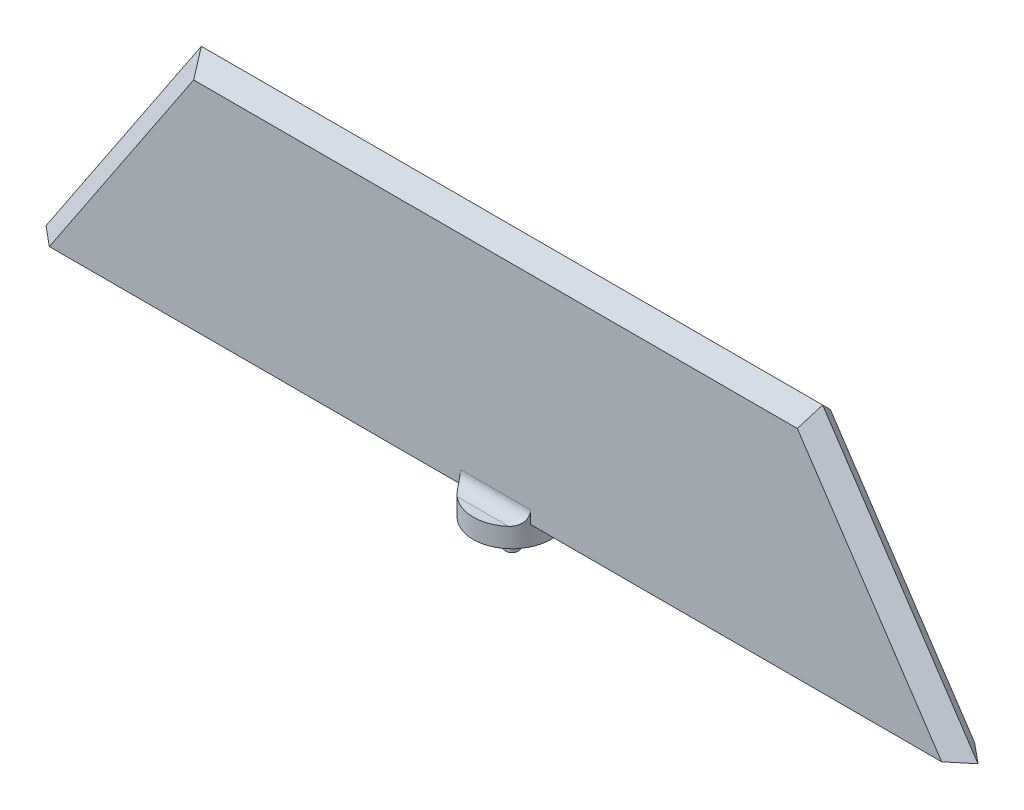
from build123d import *

# Parameters (mm, degrees)
SALIENTE_EXTRUIR1_DEPTH = 2.125
CROQUIS2_R              = 5
SALIENTE_EXTRUIR2_DEPTH = 2.5
REDONDEO1_R             = 1.625
SKETCH1_R               = 2.45
CUT_EXTRUDE1_DEPTH      = 3.1
CHAMFER1_SIZE           = 2.125
CROQUIS3_R              = 0.8
SALIENTE_EXTRUIR3_DEPTH = 6.5


# Some blends are built 0.0001 mm under size
with BuildPart() as part:
    # Croquis1 → Saliente-Extruir1 (new, symmetric)
    with BuildSketch(Plane.XY):
        Polygon((60, 0), (-60, 0), (-40, 30), (40, 30), align=None)
    extrude(amount=SALIENTE_EXTRUIR1_DEPTH, both=True)

    # Croquis2 → Saliente-Extruir2 (add)
    with BuildSketch(Plane.XZ):
        with Locations(Location((0, 0, 0), (0, 0, 25.150663413))):
            Circle(CROQUIS2_R)
    extrude(amount=SALIENTE_EXTRUIR2_DEPTH)

    # Redondeo1
    # the kernel refuses this fillet: 1.625 mm, written as the material it adds along each edge
    with BuildSketch(Plane(origin=(8.588466748, 0, -2.125), x_dir=(0, 1, 0), z_dir=(-1, 0, 0))) as redondeo1_piece_1_section:
        with BuildLine():
            CenterArc((REDONDEO1_R, REDONDEO1_R), REDONDEO1_R, 180, 90)
            Line((0, REDONDEO1_R), (0, 0))
            Line((0, 0), (REDONDEO1_R, 0))
        make_face()
    redondeo1_piece_1 = extrude(amount=17.176933495, mode=Mode.PRIVATE)
    redondeo1_piece_1 = redondeo1_piece_1 & Plane(origin=(0, 0.370660795, 0), x_dir=(0.9051933495081991, 0, 0.4250000000072087), z_dir=(0, 1, 0)) * Cylinder(5, 41, mode=Mode.PRIVATE)
    add(redondeo1_piece_1)
    with BuildSketch(Plane(origin=(8.588466748, 0, 2.125), x_dir=(0, 1, 0), z_dir=(-1, 0, 0))) as redondeo1_piece_2_section:
        with BuildLine():
            CenterArc((REDONDEO1_R, -REDONDEO1_R), REDONDEO1_R, 90, 90)
            Line((0, -REDONDEO1_R), (0, 0))
            Line((0, 0), (REDONDEO1_R, 0))
        make_face()
    redondeo1_piece_2 = extrude(amount=17.176933495, mode=Mode.PRIVATE)
    redondeo1_piece_2 = redondeo1_piece_2 & Plane(origin=(0, 0.370660827, 0), x_dir=(0.9051933495081991, 0, 0.4250000000072087), z_dir=(0, 1, 0)) * Cylinder(5, 41, mode=Mode.PRIVATE)
    add(redondeo1_piece_2)

    # Sketch1 → Cut-Extrude1 (cut)
    with BuildSketch(Plane.XZ.offset(2.5)):
        with Locations(Location((0, 0, 0), (0, 0, 270))):
            Circle(SKETCH1_R)
    extrude(amount=-CUT_EXTRUDE1_DEPTH, mode=Mode.SUBTRACT)

    # Chamfer1
    chamfer1_edges = [part.edges().sort_by_distance(p)[0] for p in [
        (50, 15, -2.125),
        (0, 30, -2.125),
        (-50, 15, -2.125),
        (50, 15, 2.125),
        (0, 30, 2.125),
        (-50, 15, 2.125),
    ]]
    chamfer(chamfer1_edges, length=CHAMFER1_SIZE - 0.0001)  # a hair under: the kernel refuses the full size

    # Croquis3 → Saliente-Extruir3 (add)
    with BuildSketch(Plane.XZ.offset(-0.6)):
        with Locations(Location((0, 0, 0), (0, 0, 90))):
            Circle(CROQUIS3_R)
    extrude(amount=SALIENTE_EXTRUIR3_DEPTH)


solid = part.part
